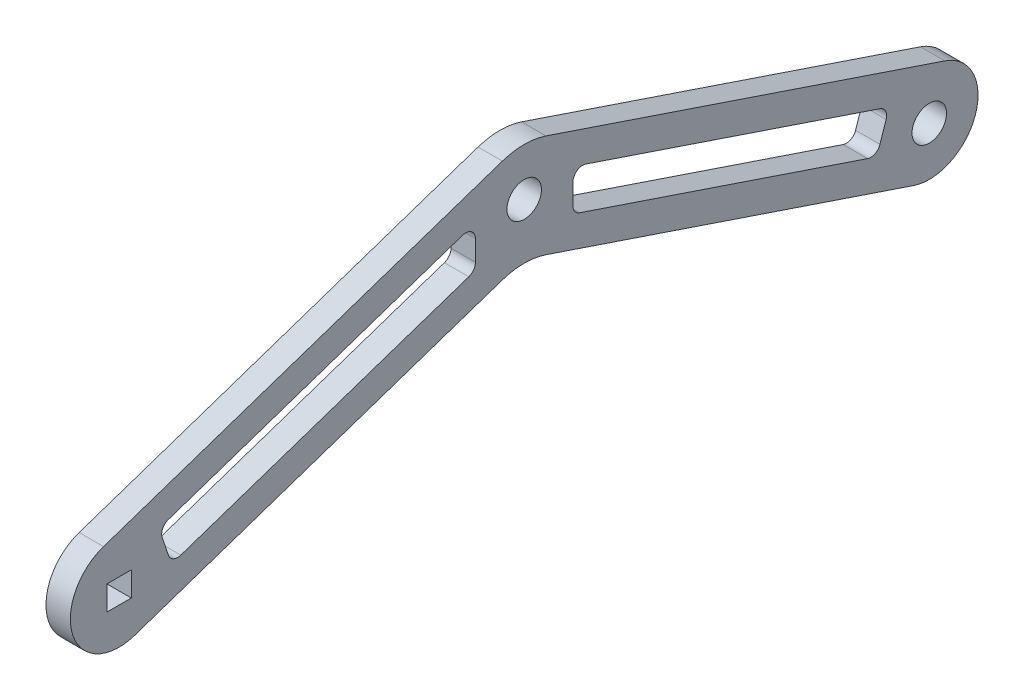
from build123d import *

# Parameters (mm, degrees)
SKETCH1_R           = 2.24506403
SKETCH1_W           = 3.175
SKETCH1_H           = 3.175
BOSS_EXTRUDE1_DEPTH = 3.175


with BuildPart() as part:
    # Sketch1 → Boss-Extrude1 (new body)
    with BuildSketch(Plane(origin=(0, 0, 0), x_dir=(0, 0, -1), z_dir=(1, 0, 0))):
        with BuildLine():
            Line((-107.539625798, 6.017442261), (-55.595036117, 23.524044464))
            ThreePointArc((-55.595036117, 23.524044464), (-52.7558, 23.989625299), (-49.916563883, 23.524044464))
            Line((-49.916563883, 23.524044464), (2.028025798, 6.017442261))
            ThreePointArc((2.028025798, 6.017442261), (6.017442261, -2.028025798), (-2.028025798, -6.017442261))
            Line((-2.028025798, -6.017442261), (-49.916563883, 10.12217096))
            ThreePointArc((-49.916563883, 10.12217096), (-52.7558, 10.587751795), (-55.595036117, 10.12217096))
            Line((-55.595036117, 10.12217096), (-103.483574202, -6.017442261))
            ThreePointArc((-103.483574202, -6.017442261), (-111.529042261, -2.028025798), (-107.539625798, 6.017442261))
        make_face()
        Circle(SKETCH1_R, mode=Mode.SUBTRACT)
        with Locations((-52.7558, 17.78)):
            Circle(SKETCH1_R, mode=Mode.SUBTRACT)
        with Locations((-105.5116, 0)):
            Rectangle(SKETCH1_W, SKETCH1_H, mode=Mode.SUBTRACT)
        with BuildLine():
            Line((-99.899762899, 3.23151425), (-99.08855258, 0.824537346))
            ThreePointArc((-99.08855258, 0.824537346), (-98.449252814, 0.092341501), (-97.479458968, 0.026654053))
            Line((-97.479458968, 0.026654053), (-59.97019484, 12.668197091))
            ThreePointArc((-59.97019484, 12.668197091), (-59.344291747, 13.130813946), (-59.1058, 13.871685543))
            Line((-59.1058, 13.871685543), (-59.1058, 16.552060244))
            ThreePointArc((-59.1058, 16.552060244), (-59.634928403, 17.583568497), (-60.78140516, 17.755548696))
            Line((-60.78140516, 17.755548696), (-99.101879606, 4.840607862))
            ThreePointArc((-99.101879606, 4.840607862), (-99.834075451, 4.201308097), (-99.899762899, 3.23151425))
        make_face(mode=Mode.SUBTRACT)
        with BuildLine():
            Line((-45.54140516, 12.668197091), (-8.032141032, 0.026654053))
            ThreePointArc((-8.032141032, 0.026654053), (-7.062347186, 0.092341501), (-6.42304742, 0.824537346))
            Line((-6.42304742, 0.824537346), (-5.611837101, 3.23151425))
            ThreePointArc((-5.611837101, 3.23151425), (-5.677524549, 4.201308097), (-6.409720394, 4.840607862))
            Line((-6.409720394, 4.840607862), (-44.73019484, 17.755548696))
            ThreePointArc((-44.73019484, 17.755548696), (-45.876671597, 17.583568497), (-46.4058, 16.552060244))
            Line((-46.4058, 16.552060244), (-46.4058, 13.871685543))
            ThreePointArc((-46.4058, 13.871685543), (-46.167308253, 13.130813946), (-45.54140516, 12.668197091))
        make_face(mode=Mode.SUBTRACT)
    extrude(amount=BOSS_EXTRUDE1_DEPTH)


solid = part.part
